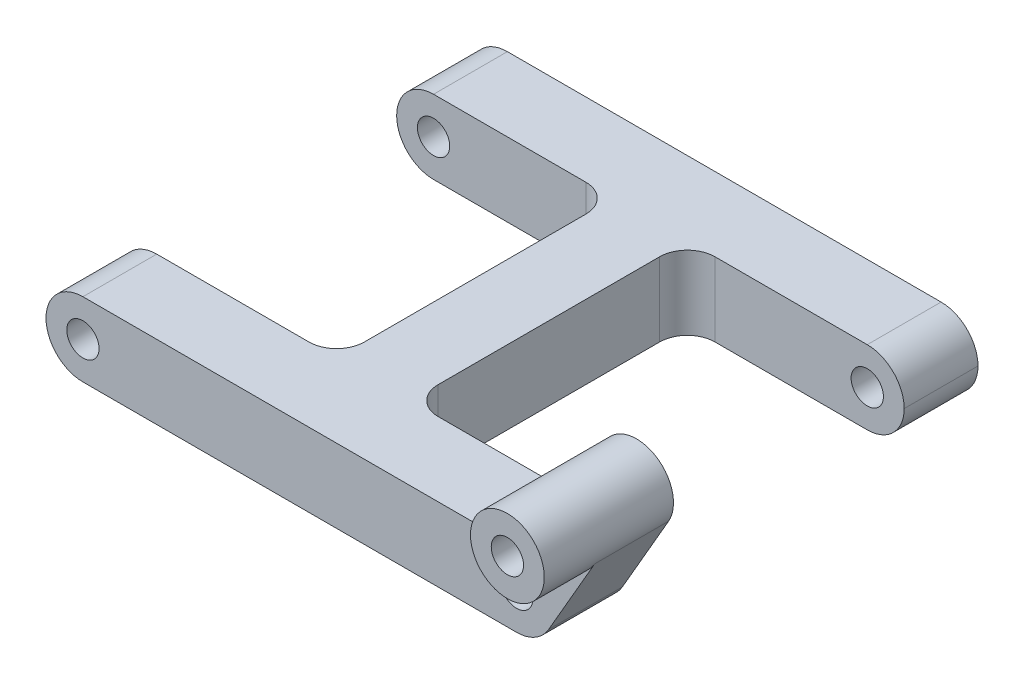
from build123d import *
from build123d.topology import SkipClean

# Parameters (mm, degrees)
SALIENTE_EXTRUIR1_DEPTH = 4
CROQUIS3_R              = 1.75
CORTAR_EXTRUIR1_DEPTH   = 54.742441329
REDONDEO8_R             = 4
REDONDEO9_R             = 3
SALIENTE_EXTRUIR3_START = -46
CROQUIS5_R              = 1.75
SALIENTE_EXTRUIR3_DEPTH = 8
SALIENTE_EXTRUIR2_START = 52
CROQUIS4_R              = 4
CROQUIS4_R_2            = 1.75
SALIENTE_EXTRUIR2_DEPTH = 6
CROQUIS6_R              = 3.1
CORTAR_EXTRUIR2_DEPTH   = 3.2


with BuildPart() as part:
    # Croquis2 → Saliente-Extruir1 (new, symmetric)
    with BuildSketch(Plane(origin=(0, 0, 0), x_dir=(1, 0, 0), z_dir=(0, 1, 0))):
        Polygon((27.5, -23), (27.5, -15), (4, -15), (4, 15), (27.5, 15), (27.5, 23), (-27.5, 23), (-27.5, 15), (-4, 15), (-4, -15), (-27.5, -15), (-27.5, -23), align=None)
    extrude(amount=SALIENTE_EXTRUIR1_DEPTH, both=True)

    # Croquis3 → Cortar-Extruir1 (cut, through all)
    with BuildSketch(Plane.XY.offset(23)):
        with Locations((23.5, 0)):
            Circle(CROQUIS3_R)
        with Locations((-23.5, 0)):
            Circle(CROQUIS3_R)
    extrude(amount=-CORTAR_EXTRUIR1_DEPTH, mode=Mode.SUBTRACT)

    # Redondeo8
    redondeo8_edges = [part.edges().sort_by_distance(p)[0] for p in [
        (27.5, -4, -19),
        (27.5, 4, -19),
        (27.5, -4, 19),
        (27.5, 4, 19),
        (-27.5, -4, -19),
        (-27.5, 4, -19),
        (-27.5, -4, 19),
        (-27.5, 4, 19),
    ]]
    fillet(redondeo8_edges, radius=REDONDEO8_R - 0.0001)  # a hair under: the kernel refuses the full size

    # Redondeo9
    redondeo9_edges = [part.edges().sort_by_distance(p)[0] for p in [
        (4, 0, -15),
        (4, 0, 15),
        (-4, 0, 15),
        (-4, 0, -15),
    ]]
    fillet(redondeo9_edges, radius=REDONDEO9_R)

    # Croquis5 → Saliente-Extruir3 (add)
    with BuildSketch(Plane(origin=(0, 0, -23), x_dir=(-1, 0, 0), z_dir=(0, 0, -1)).offset(SALIENTE_EXTRUIR3_START)):
        with BuildLine():
            Line((-25.035898385, 10.660254038), (-20.035898385, 2))
            ThreePointArc((-20.035898385, 2), (-21.5, -3.464101615), (-26.964101615, -2))
            Line((-26.964101615, -2), (-31.964101615, 6.660254038))
            ThreePointArc((-31.964101615, 6.660254038), (-30.5, 12.124355653), (-25.035898385, 10.660254038))
        make_face()
        with Locations(Location((-23.5, 0, 0), (0, 0, 180))):
            Circle(CROQUIS5_R, mode=Mode.SUBTRACT)
        with Locations(Location((-28.5, 8.660254038, 0), (0, 0, 180))):
            Circle(CROQUIS5_R, mode=Mode.SUBTRACT)
    extrude(amount=SALIENTE_EXTRUIR3_DEPTH)

    # Croquis4 → Saliente-Extruir2 (add)
    with SkipClean():  # the faces are left unmerged after this step: merging them gives an invalid solid
        with BuildSketch(Plane.XY.offset(-23).offset(SALIENTE_EXTRUIR2_START)):
            with Locations(Location((28.5, 8.660254038, 0), (0, 0, 180))):
                Circle(CROQUIS4_R)
            with Locations(Location((28.5, 8.660254038, 0), (0, 0, 180))):
                Circle(CROQUIS4_R_2, mode=Mode.SUBTRACT)
        extrude(amount=-SALIENTE_EXTRUIR2_DEPTH)

    # Croquis6 → Cortar-Extruir2 (cut)
    with SkipClean():  # the faces are left unmerged after this step: merging them gives an invalid solid
        with BuildSketch(Plane(origin=(0, 0, -23), x_dir=(-1, 0, 0), z_dir=(0, 0, -1))):
            with Locations((23.5, 0)):
                Circle(CROQUIS6_R)
        extrude(amount=-CORTAR_EXTRUIR2_DEPTH, mode=Mode.SUBTRACT)


solid = part.part
